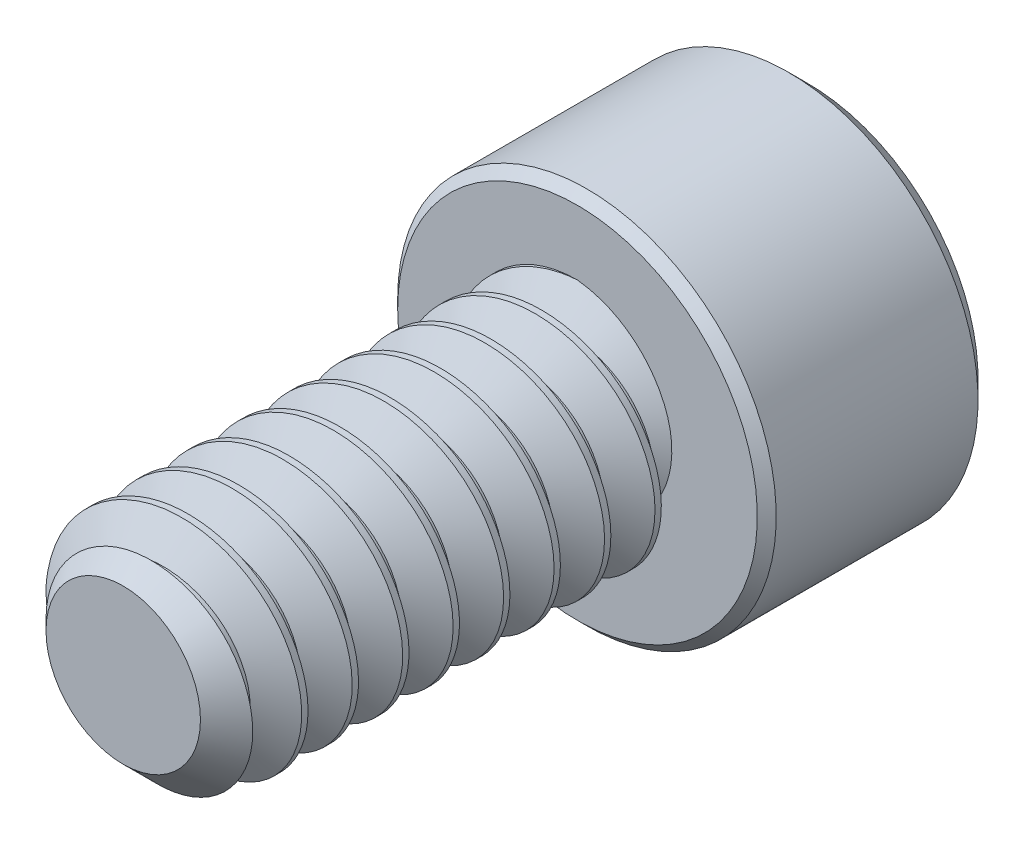
from build123d import *

# Parameters (mm, degrees)
SKETCH1_R          = 2.413
EXTRUDE1_DEPTH     = 9.525
CHAMFER3_SIZE      = 0.79375
CUT_SWEEP1_PITCH   = 1.058333333
SKETCH6_R          = 3.96875
EXTRUDE2_DEPTH     = 4.826
CUT_EXTRUDE1_DEPTH = 2.9765625
CHAMFER1_SIZE      = 0.396875
CHAMFER2_SIZE      = 0.1984375


with BuildPart() as part:
    # Sketch1 → Extrude1 (new body)
    with BuildSketch(Plane.XY):
        Circle(SKETCH1_R)
    extrude(amount=-EXTRUDE1_DEPTH)

    # Chamfer3
    chamfer3_edges = [part.edges().sort_by_distance(p)[0] for p in [
        (-2.413, 0, 0),
    ]]
    chamfer(chamfer3_edges, length=CHAMFER3_SIZE)

    # Cut-Sweep1: the profile of Sketch3 profile screwed along a right-hand helix of 10 turns, 6 arcs to a turn; built about Z, then put on its axis
    cut_sweep1_z = Axis((0, 0, 0), (0, 0, 1))
    cut_sweep1_corners = [(2.4133, 0, -0.926214872), (1.725592336, 0, -0.529166667), (1.725592336, 0, -0.396875), (2.4133, 0, 0.000173205)]
    with BuildLine(mode=Mode.PRIVATE) as cut_sweep1_profile:
        Line(cut_sweep1_corners[0], cut_sweep1_corners[1])
        Line(cut_sweep1_corners[1], cut_sweep1_corners[2])
        Line(cut_sweep1_corners[2], cut_sweep1_corners[3])
        Line(cut_sweep1_corners[3], cut_sweep1_corners[0])
    cut_sweep1_cap = Face(cut_sweep1_profile.wire())
    cut_sweep1_turn_angles = [0, 30, 60, 90, 120, 150, 180, 210, 240, 270, 300, 330, 360]
    cut_sweep1_turn_weights = [1, 0.8660254037844387, 1, 0.8660254037844387, 1, 0.8660254037844387, 1, 0.8660254037844387, 1, 0.8660254037844387, 1, 0.8660254037844387, 1]
    cut_sweep1_turn_rails = [Edge.make_bspline([Vector(p[0], p[1], 0).rotate(cut_sweep1_z, cut_sweep1_turn_angles[k]) / cut_sweep1_turn_weights[k] + Vector(0, 0, p[2] + CUT_SWEEP1_PITCH * cut_sweep1_turn_angles[k] / 360) for k in range(13)], [0, 0, 0, 1, 1, 2, 2, 3, 3, 4, 4, 5, 5, 6, 6, 6], 2, cut_sweep1_turn_weights) for p in cut_sweep1_corners]
    cut_sweep1_turn_sides = [Face.make_surface_from_curves(cut_sweep1_turn_rails[p[0]], cut_sweep1_turn_rails[p[1]]) for p in [(0, 1), (1, 2), (2, 3), (3, 0)]]
    cut_sweep1 = Plane(origin=(0, 0, 0), x_dir=(0, 1, 0), z_dir=(0, 0, -1)) * Solid(Shell([*[p.moved(Location((0, 0, CUT_SWEEP1_PITCH * i))) for i in range(10) for p in cut_sweep1_turn_sides], cut_sweep1_cap, cut_sweep1_cap.rotate(cut_sweep1_z, 3600).moved(Location((0, 0, CUT_SWEEP1_PITCH * 3600 / 360)))]))
    add(cut_sweep1, mode=Mode.SUBTRACT)

    # Sketch6 → Extrude2 (add)
    with BuildSketch(Plane(origin=(0, 0, -9.525), x_dir=(-1, 0, 0), z_dir=(0, 0, -1))):
        Circle(SKETCH6_R)
    extrude(amount=EXTRUDE2_DEPTH)

    # Sketch7 → Cut-Extrude1 (cut)
    with BuildSketch(Plane(origin=(0, 0, -14.351), x_dir=(-1, 0, 0), z_dir=(0, 0, -1))):
        Polygon((0, 2.291358881), (-1.984375, 1.14567944), (-1.984375, -1.14567944), (0, -2.291358881), (1.984375, -1.14567944), (1.984375, 1.14567944), align=None)
    extrude(amount=-CUT_EXTRUDE1_DEPTH, mode=Mode.SUBTRACT)

    # Cut-Extrude2 cone 1 section (through the dimple's axis) → Cut-Extrude2 (revolve, cut)
    with BuildSketch(Plane(origin=(0, 0, -14.351), x_dir=(0, 1, 0), z_dir=(1, 0, 0))):
        Polygon((0, 0), (2.291358881, 0), (0, 2.291358881), align=None)
    revolve(axis=Axis((0, 0, -14.351), (0, 0, 1)), mode=Mode.SUBTRACT)

    # Chamfer1
    chamfer1_edges = [part.edges().sort_by_distance(p)[0] for p in [
        (3.96875, 0, -14.351),
    ]]
    chamfer(chamfer1_edges, length=CHAMFER1_SIZE)

    # Chamfer2
    chamfer2_edges = [part.edges().sort_by_distance(p)[0] for p in [
        (3.96875, 0, -9.525),
    ]]
    chamfer(chamfer2_edges, length=CHAMFER2_SIZE)


solid = part.part
